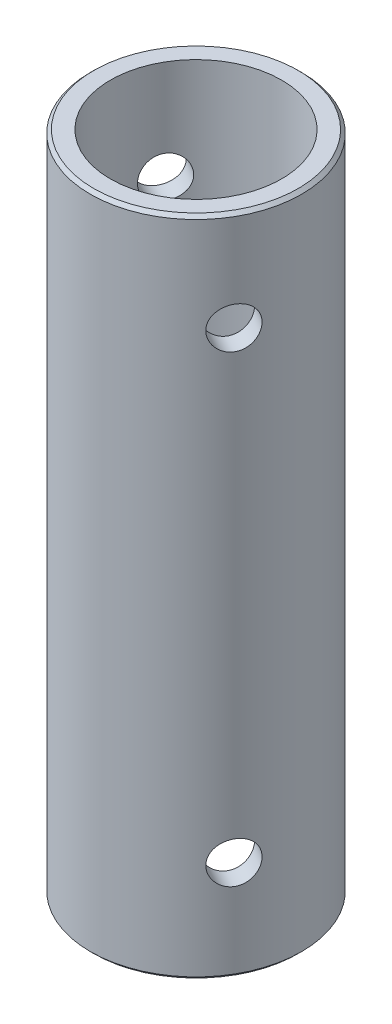
from build123d import *

# Parameters (mm, degrees)
SKETCH1_R               = 7.94
SKETCH1_R_2             = 6.44
BOSS_EXTRUDE1_DEPTH     = 49.82
CHAMFER1_SIZE           = 0.25
CUT_EXTRUDE1_DEPTH      = 53.623598584
CUT_EXTRUDE1_DEPTH_BACK = 53.623598584
SKETCH2_R               = 1.55
CUT_EXTRUDE2_DEPTH      = 53.623598724
CUT_EXTRUDE2_DEPTH_BACK = 53.623598724
SKETCH3_R               = 1.55


with BuildPart() as part:
    # Sketch1 → Boss-Extrude1 (new body)
    with BuildSketch(Plane(origin=(0, 0, 0), x_dir=(1, 0, 0), z_dir=(0, 1, 0))):
        Circle(SKETCH1_R)
        Circle(SKETCH1_R_2, mode=Mode.SUBTRACT)
    extrude(amount=BOSS_EXTRUDE1_DEPTH)

    # Chamfer1
    chamfer1_edges = [part.edges().sort_by_distance(p)[0] for p in [
        (-7.94, 0, 0),
        (-7.94, 49.82, 0),
    ]]
    chamfer(chamfer1_edges, length=CHAMFER1_SIZE)

    # Sketch2 → Cut-Extrude1 (cut, two sides: drawn at the far end of the back side and taken through both)
    with BuildSketch(Plane(origin=(-5.066248612, 0, -2.925), x_dir=(-0.49999999999999983, 0, 0.8660254037844388), z_dir=(-0.8660254037844387, 0, -0.4999999999999998)).offset(-CUT_EXTRUDE1_DEPTH_BACK)):
        with Locations((0, 7.5)):
            Circle(SKETCH2_R)
    extrude(amount=CUT_EXTRUDE1_DEPTH + CUT_EXTRUDE1_DEPTH_BACK, mode=Mode.SUBTRACT)

    # Sketch3 → Cut-Extrude2 (cut, two sides: drawn at the far end of the back side and taken through both)
    with BuildSketch(Plane(origin=(-5.066248612, 0, -2.925), x_dir=(-0.5000000000000003, 0, 0.8660254037844386), z_dir=(-0.8660254037844385, 0, -0.5000000000000002)).offset(-CUT_EXTRUDE2_DEPTH_BACK)):
        with Locations((0, 42.32)):
            Circle(SKETCH3_R)
    extrude(amount=CUT_EXTRUDE2_DEPTH + CUT_EXTRUDE2_DEPTH_BACK, mode=Mode.SUBTRACT)


solid = part.part
